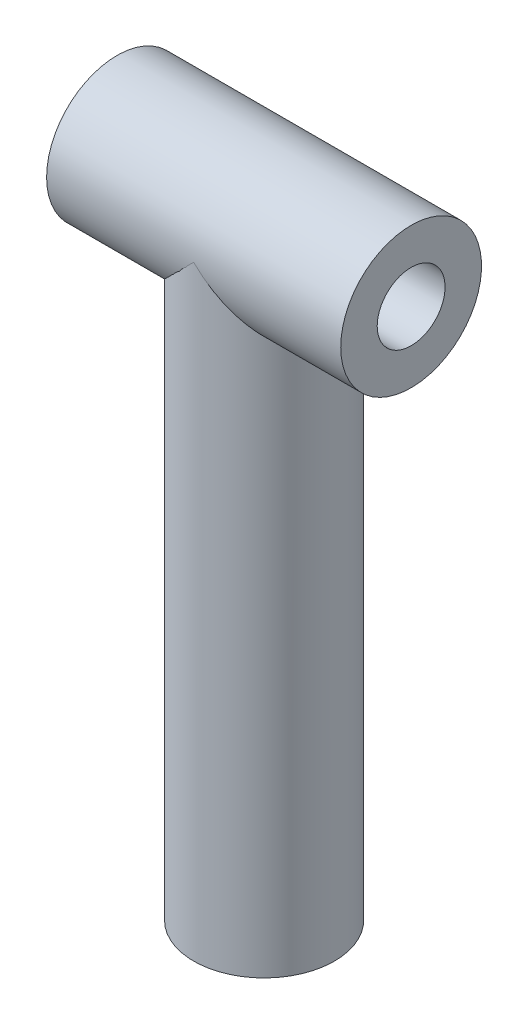
from build123d import *

# Parameters (mm, degrees)
PIPE_START                      = -107
PIPE_26_9_X_3_2_1_OUTLINE_R     = 12.445
PIPE_26_9_X_3_2_1_OUTLINE_R_2   = 5
PIPE_26_9_X_3_2_1_DEPTH         = 94.5549999
PIPE_START_2                    = -12.4450001
PIPE_26_9_X_3_2_1_2_OUTLINE_R   = 12.445
PIPE_26_9_X_3_2_1_2_OUTLINE_R_2 = 5
PIPE_26_9_X_3_2_1_2_DEPTH       = 12.4450002
PIPE_START_3                    = -13
PIPE_26_9_X_3_2_1_3_DEPTH       = 26
PIPE_START_4                    = -26
PIPE_26_9_X_3_2_1_4_OUTLINE_R   = 12.445
PIPE_26_9_X_3_2_1_4_OUTLINE_R_2 = 5
PIPE_26_9_X_3_2_1_4_DEPTH       = 52
SKETCH13_R                      = 6
CUT_EXTRUDE1_DEPTH              = 57


with BuildPart() as part:
    # Pipe 26.9 X 3.2(1): read off the stored shape, not the designer's step
    # Pipe 26.9 X 3.2(1) outline → Pipe 26.9 X 3.2(1) (new body)
    with BuildSketch(Plane(origin=(0, 0, 0), x_dir=(1, 0, 0), z_dir=(0, 1, 0)).offset(PIPE_START)):
        Circle(PIPE_26_9_X_3_2_1_OUTLINE_R)
        Circle(PIPE_26_9_X_3_2_1_OUTLINE_R_2, mode=Mode.SUBTRACT)
    extrude(amount=PIPE_26_9_X_3_2_1_DEPTH)

    # Pipe 26.9 X 3.2_1 2 outline → Pipe 26.9 X 3.2_1 2 (add)
    with BuildSketch(Plane(origin=(0, 0, 0), x_dir=(1, 0, 0), z_dir=(0, 1, 0)).offset(PIPE_START_2)):
        Circle(PIPE_26_9_X_3_2_1_2_OUTLINE_R)
        Circle(PIPE_26_9_X_3_2_1_2_OUTLINE_R_2, mode=Mode.SUBTRACT)
    extrude(amount=PIPE_26_9_X_3_2_1_2_DEPTH)

    # Pipe 26.9 X 3.2_1 3 outline → Pipe 26.9 X 3.2_1 3 (cut)
    with BuildSketch(Plane.YZ.offset(PIPE_START_3)):
        with BuildLine():
            ThreePointArc((0, 12.445), (-12.445, 0), (0, -12.445))
            Line((0, -12.445), (0, 12.445))
        make_face()
    extrude(amount=PIPE_26_9_X_3_2_1_3_DEPTH, mode=Mode.SUBTRACT)


with BuildPart() as body_2:
    # Pipe 26.9 X 3.2_1 4 outline → Pipe 26.9 X 3.2_1 4 (new body)
    with BuildSketch(Plane.YZ.offset(PIPE_START_4)):
        Circle(PIPE_26_9_X_3_2_1_4_OUTLINE_R)
        Circle(PIPE_26_9_X_3_2_1_4_OUTLINE_R_2, mode=Mode.SUBTRACT)
    extrude(amount=PIPE_26_9_X_3_2_1_4_DEPTH)

    # Sketch13 → Cut-Extrude1 (cut)
    with BuildSketch(Plane.ZY.offset(26)):
        Circle(SKETCH13_R)
    extrude(amount=-CUT_EXTRUDE1_DEPTH, mode=Mode.SUBTRACT)


solid = Compound([part.part, body_2.part])
